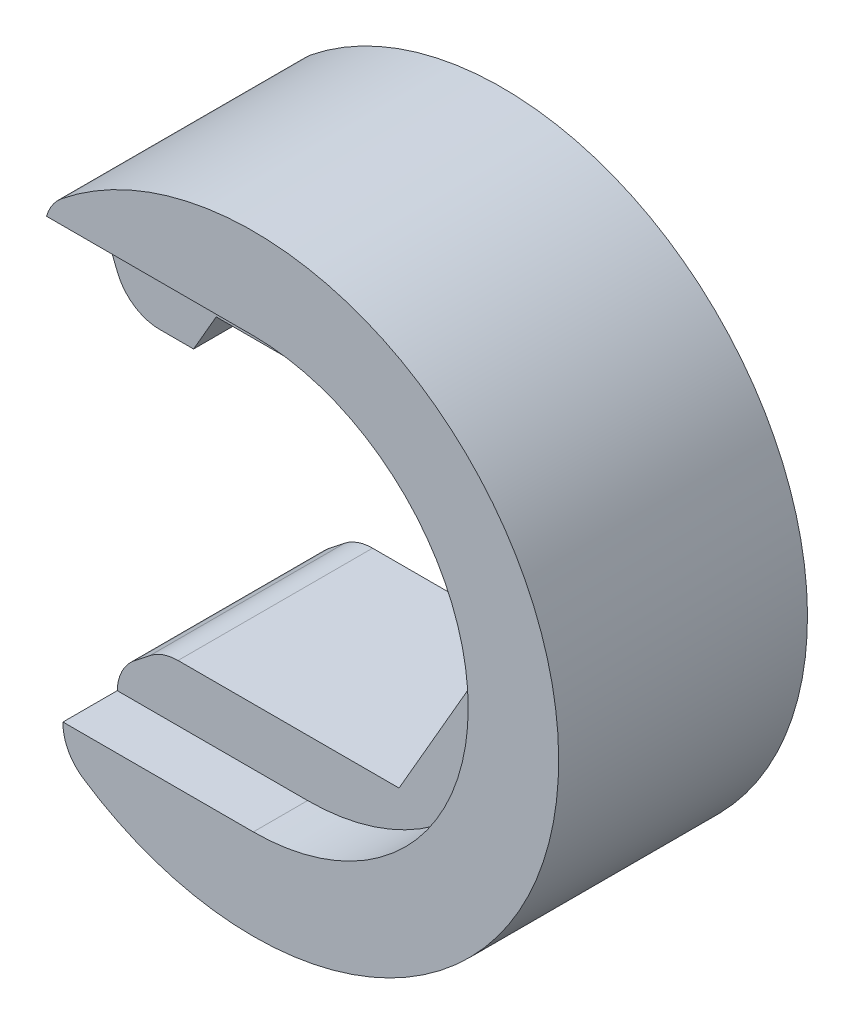
from build123d import *

# Parameters (mm, degrees)
BOSS_EXTRUDE1_DEPTH = 4.3
BOSS_EXTRUDE4_DEPTH = 5.5
FILLET4_R           = 1


with BuildPart() as part:
    # Sketch1 → Boss-Extrude1 (new body)
    with BuildSketch(Plane.XY):
        with BuildLine():
            Line((-2.020725942, -3.5), (-3.211308145, -3.5))
            ThreePointArc((-3.211308145, -3.5), (4.715670166, 0.570048145), (-3.952806323, 2.633974596))
            Line((-3.952806323, 2.633974596), (-2.520725942, 2.633974596))
            Line((-2.520725942, 2.633974596), (-2.020725942, 3.5))
            Line((-2.020725942, 3.5), (2.020725942, 3.5))
            Line((2.020725942, 3.5), (4.041451884, 0))
            Line((4.041451884, 0), (2.020725942, -3.5))
            Line((2.020725942, -3.5), (-2.020725942, -3.5))
        make_face()
        with BuildLine():
            Line((-4.795831523, 4.75), (-3.952806323, 2.633974596))
            ThreePointArc((-3.952806323, 2.633974596), (-2.241776156, 4.18771294), (0, 4.75))
            Line((0, 4.75), (-4.795831523, 4.75))
        make_face()
        with BuildLine():
            Line((-3.211308145, -3.5), (-4.795831523, -4.75))
            Line((-4.795831523, -4.75), (0, -4.75))
            ThreePointArc((0, -4.75), (-1.723006094, -4.426482802), (-3.211308145, -3.5))
        make_face()
    extrude(amount=BOSS_EXTRUDE1_DEPTH)

    # Sketch1<6> → Boss-Extrude4 (add)
    with BuildSketch(Plane.XY):
        with BuildLine():
            ThreePointArc((-4.795831523, -4.75), (6.75, 0), (-4.795831523, 4.75))
            Line((-4.795831523, 4.75), (0, 4.75))
            ThreePointArc((0, 4.75), (4.75, 0), (0, -4.75))
            Line((0, -4.75), (-4.795831523, -4.75))
        make_face()
    extrude(amount=BOSS_EXTRUDE4_DEPTH)

    # Fillet4
    # the kernel refuses this fillet: 1 mm, written as the material it takes off along each edge
    with BuildSketch(Plane(origin=(-4.795831523, -4.75, -3.339360347), x_dir=(0.7851091148875305, 0.6193574716757022, 0), z_dir=(0, 0, 1))) as fillet4_piece_1:
        with BuildLine():
            CenterArc((1.232836015, -1), FILLET4_R, 90, 107.81241463)
            ThreePointArc((0.280772882, -1.305901602), (0.108004206, -0.659913081), (0, 0))
            Line((0, 0), (1.232836015, 0))
        make_face()
    extrude(amount=10.978720693, mode=Mode.SUBTRACT)
    with BuildSketch(Plane(origin=(-3.211308145, -3.5, -0.867394417), x_dir=(1, 0, 0), z_dir=(0, 0, 1))) as fillet4_piece_2:
        with BuildLine():
            CenterArc((FILLET4_R * 0.346957766621, -FILLET4_R), FILLET4_R, 90, 38.269228819)
            Line((-FILLET4_R * 0.272399705055, -FILLET4_R * 0.214890885112), (0, 0))
            Line((0, 0), (FILLET4_R * 0.346957766621, 0))
        make_face()
    extrude(amount=6.034788833, mode=Mode.SUBTRACT)
    with BuildSketch(Plane(origin=(-3.952806323, 2.633974596, -1.695098898), x_dir=(-0.37010921689998283, 0.9289882494228232, 0), z_dir=(0, 0, 1))) as fillet4_piece_3:
        with BuildLine():
            CenterArc((FILLET4_R * 0.678039559156, -FILLET4_R), FILLET4_R, 90, 68.277646872)
            Line((-FILLET4_R * 0.250948690267, -FILLET4_R * 0.6298907831), (0, 0))
            Line((0, 0), (FILLET4_R * 0.678039559156, 0))
        make_face()
    extrude(amount=7.690197796, mode=Mode.SUBTRACT)
    with BuildSketch(Plane(origin=(-4.795831523, 4.75, -1.879489211), x_dir=(0.7421780572784941, 0.6702027538695439, 0), z_dir=(0, 0, 1))) as fillet4_piece_4:
        with BuildLine():
            CenterArc((0.696107115, -0.998448188), FILLET4_R, 86.807628526, 72.832009231)
            Line((-0.241415796, -0.650524644), (0, 0))
            ThreePointArc((0, 0), (0.375897842, 0.010474734), (0.751795684, 0))
        make_face()
    extrude(amount=8.058978421, mode=Mode.SUBTRACT)


solid = part.part
